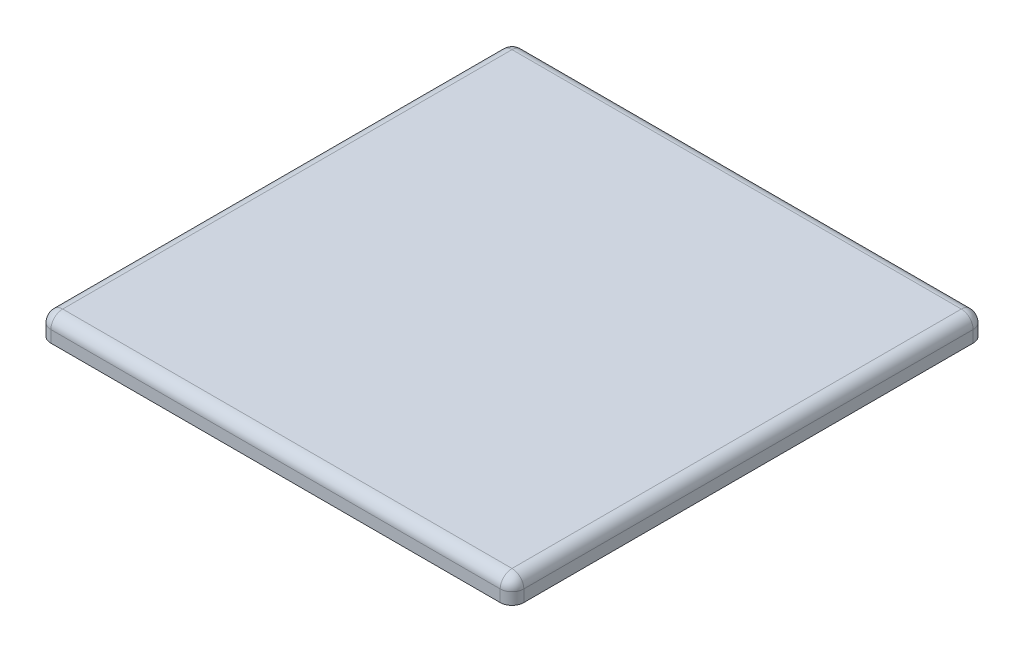
from build123d import *

# Parameters (mm, degrees)
SKETCH1_W           = 508
SKETCH1_H           = 508
BOSS_EXTRUDE1_DEPTH = 25.4
FILLET1_R           = 12.7
FILLET2_R           = 12.7


with BuildPart() as part:
    # Sketch1 → Boss-Extrude1 (new body)
    with BuildSketch(Plane(origin=(0, 0, 0), x_dir=(1, 0, 0), z_dir=(0, 1, 0))):
        Rectangle(SKETCH1_W, SKETCH1_H)
    extrude(amount=BOSS_EXTRUDE1_DEPTH)

    # Fillet1
    fillet1_edges = [part.edges().sort_by_distance(p)[0] for p in [
        (-254, 25.4, 0),
        (0, 25.4, 254),
        (254, 25.4, 0),
        (0, 25.4, -254),
    ]]
    fillet(fillet1_edges, radius=FILLET1_R)

    # Fillet2
    # the kernel refuses this fillet: 12.7 mm, written as the material it takes off along each edge
    with BuildSketch(Plane(origin=(241.3, 12.7, 241.3), x_dir=(0, 0, 1), z_dir=(1, 0, 0))) as fillet2_piece_1_section:
        Polygon((0, 0), (FILLET2_R, 0), (FILLET2_R, -FILLET2_R), (0, -FILLET2_R), align=None)
    fillet2_piece_1 = extrude(amount=FILLET2_R, mode=Mode.PRIVATE)
    fillet2_piece_1 = fillet2_piece_1 - Plane(origin=(241.3, 12.7, 241.3), x_dir=(0, -0.7071067811865475, -0.7071067811865475), z_dir=(1, 0, 0)) * Sphere(FILLET2_R, mode=Mode.PRIVATE)
    add(fillet2_piece_1, mode=Mode.SUBTRACT)
    with BuildSketch(Plane(origin=(-241.3, 12.7, 241.3), x_dir=(0, 0, 1), z_dir=(-1, 0, 0))) as fillet2_piece_2_section:
        Polygon((0, 0), (FILLET2_R, 0), (FILLET2_R, FILLET2_R), (0, FILLET2_R), align=None)
    fillet2_piece_2 = extrude(amount=FILLET2_R, mode=Mode.PRIVATE)
    fillet2_piece_2 = fillet2_piece_2 - Plane(origin=(-241.3, 12.7, 241.3), x_dir=(0, -0.7071067811865475, -0.7071067811865475), z_dir=(-1, 0, 0)) * Sphere(FILLET2_R, mode=Mode.PRIVATE)
    add(fillet2_piece_2, mode=Mode.SUBTRACT)
    with BuildSketch(Plane(origin=(241.3, 12.7, -241.3), x_dir=(1, 0, 0), z_dir=(0, 0, -1))) as fillet2_piece_3_section:
        Polygon((0, 0), (FILLET2_R, 0), (FILLET2_R, -FILLET2_R), (0, -FILLET2_R), align=None)
    fillet2_piece_3 = extrude(amount=FILLET2_R, mode=Mode.PRIVATE)
    fillet2_piece_3 = fillet2_piece_3 - Plane(origin=(241.3, 12.7, -241.3), x_dir=(-0.7071067811865475, -0.7071067811865475, 0), z_dir=(0, 0, -1)) * Sphere(FILLET2_R, mode=Mode.PRIVATE)
    add(fillet2_piece_3, mode=Mode.SUBTRACT)
    with BuildSketch(Plane(origin=(-241.3, 12.7, -241.3), x_dir=(-1, 0, 0), z_dir=(0, 0, -1))) as fillet2_piece_4_section:
        Polygon((0, 0), (FILLET2_R, 0), (FILLET2_R, FILLET2_R), (0, FILLET2_R), align=None)
    fillet2_piece_4 = extrude(amount=FILLET2_R, mode=Mode.PRIVATE)
    fillet2_piece_4 = fillet2_piece_4 - Plane(origin=(-241.3, 12.7, -241.3), x_dir=(0.7071067811865475, -0.7071067811865475, 0), z_dir=(0, 0, -1)) * Sphere(FILLET2_R, mode=Mode.PRIVATE)
    add(fillet2_piece_4, mode=Mode.SUBTRACT)
    with BuildSketch(Plane(origin=(-254, -31.75, -254), x_dir=(1, 0, 0), z_dir=(0, 1, 0)), Plane(origin=(-254, -31.75, 254), x_dir=(0, 0, -1), z_dir=(0, 1, 0))) as fillet2_piece_5:
        with BuildLine():
            CenterArc((FILLET2_R, -FILLET2_R), FILLET2_R, 90, 90)
            Line((0, -FILLET2_R), (0, 0))
            Line((0, 0), (FILLET2_R, 0))
        make_face()
    extrude(amount=44.45, mode=Mode.SUBTRACT)
    with BuildSketch(Plane(origin=(254, -31.75, -254), x_dir=(-1, 0, 0), z_dir=(0, 1, 0)), Plane(origin=(254, -31.75, 254), x_dir=(0, 0, -1), z_dir=(0, 1, 0))) as fillet2_piece_6:
        with BuildLine():
            CenterArc((FILLET2_R, FILLET2_R), FILLET2_R, 180, 90)
            Line((0, FILLET2_R), (0, 0))
            Line((0, 0), (FILLET2_R, 0))
        make_face()
    extrude(amount=44.45, mode=Mode.SUBTRACT)


solid = part.part
